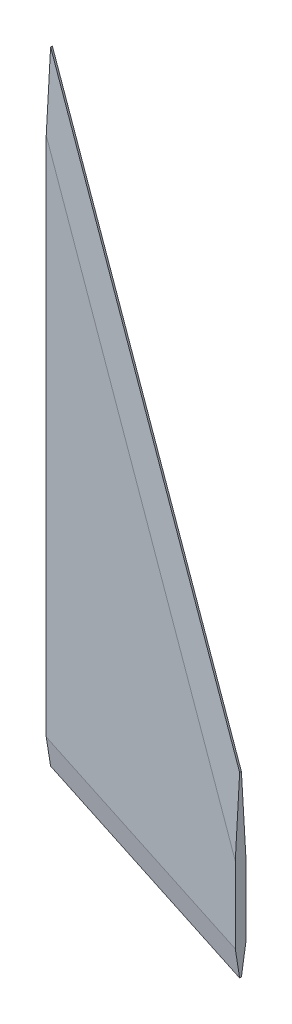
from build123d import *
from OCP.BRepFilletAPI import BRepFilletAPI_MakeChamfer

# Parameters (mm, degrees)
BOSS_EXTRUDE1_DEPTH = 1.5
CHAMFER1_SIZE       = 1.25
CHAMFER1_SIZE2      = 7.089102275


with BuildPart() as part:
    # Sketch1 → Boss-Extrude1 (new, symmetric)
    with BuildSketch(Plane.XY):
        Polygon((-16.410036231, 1.315286387), (-16.410036231, 179.115286387), (37.564963769, 26.715286387), (37.564963769, -24.084713613), align=None)
    extrude(amount=BOSS_EXTRUDE1_DEPTH, both=True)

    # Chamfer1: one chamfer whose edges measure the first distance from different faces: ONE call of the kernel's chamfer builder (chamfer() names one face for all edges)
    chamfer1_edges_1 = [part.edges().sort_by_distance(p)[0] for p in [
        (10.577463769, -11.384713613, -1.5),
        (10.577463769, -11.384713613, 1.5),
    ]]
    chamfer1_side_1 = [part.faces().sort_by_distance(p)[0] for p in [
        (10.577463769, -11.384713613, 0),
    ]]
    chamfer1_edges_2 = [part.edges().sort_by_distance(p)[0] for p in [
        (10.577463769, 102.915286387, -1.5),
        (10.577463769, 102.915286387, 1.5),
    ]]
    chamfer1_side_2 = [part.faces().sort_by_distance(p)[0] for p in [
        (10.577463769, 102.915286387, 0),
    ]]
    chamfer1 = BRepFilletAPI_MakeChamfer(part.part.solid().wrapped)
    for e in chamfer1_edges_1:
        chamfer1.Add(CHAMFER1_SIZE, CHAMFER1_SIZE2, e.wrapped, chamfer1_side_1[0].wrapped)  # the first distance lies on this face
    for e in chamfer1_edges_2:
        chamfer1.Add(CHAMFER1_SIZE, CHAMFER1_SIZE2, e.wrapped, chamfer1_side_2[0].wrapped)  # the first distance lies on this face
    add(Compound.cast(chamfer1.Shape()), mode=Mode.REPLACE)


solid = part.part
